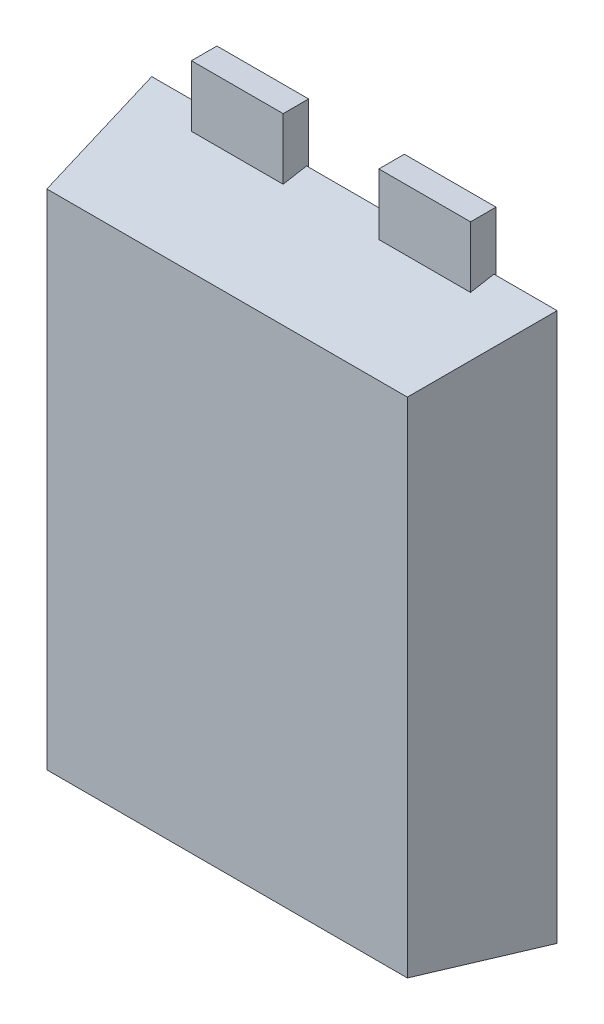
from build123d import *

# Parameters (mm, degrees)
BOSS_EXTRUDE1_DEPTH   = 0.25
SKETCH2_W             = 0.9
SKETCH2_H             = 0.85
BOSS_EXTRUDE1_2_DEPTH = 0.25
BOSS_EXTRUDE1_3_DEPTH = 0.25
SKETCH3_W             = 3.98
SKETCH3_H             = 5.38
BOSS_EXTRUDE2_DEPTH   = 1.25
CHAMFER6_SIZE         = 1.25
CHAMFER6_SIZE_2       = 0.220408726
CHAMFER7_SIZE         = 1.25
CHAMFER7_SIZE_2       = 0.220408726
CHAMFER8_SIZE         = 1.25
CHAMFER8_SIZE_2       = 0.220408726


with BuildPart() as part:
    # Sketch2 → Boss-Extrude1 (new body)
    with BuildSketch(Plane.XY):
        Polygon((-1.525, 1.15), (-1.525, -2.4), (-0.9, -2.4), (-0.9, -3.25), (-0.55, -3.25), (-0.55, -3.05), (0.55, -3.05), (0.55, -3.25), (0.9, -3.25), (0.9, -2.4), (1.525, -2.4), (1.525, 1.15), align=None)
    extrude(amount=BOSS_EXTRUDE1_DEPTH)

    # Sketch3 → Boss-Extrude2 (add)
    with BuildSketch(Plane.XY.offset(0.02)):
        Rectangle(SKETCH3_W, SKETCH3_H)
    extrude(amount=BOSS_EXTRUDE2_DEPTH)

    # Chamfer6
    # the kernel refuses this chamfer: 1.25, 0.220408726 mm, written as the material it takes off along each edge
    with BuildSketch(Plane(origin=(5.238173496, -2.69, 1.27), x_dir=(0, -0.006682531656101757, -0.9999776716360547), z_dir=(-1, 0, 0))) as chamfer6_piece_1_section:
        Polygon((CHAMFER6_SIZE * 0.999977671636, -CHAMFER6_SIZE * 0.0066825316561), (-CHAMFER6_SIZE_2 * 0.00668253165263, -CHAMFER6_SIZE_2 * 0.999977671117), (0, 0), align=None)
    chamfer6_piece_1 = extrude(amount=10.476346991, mode=Mode.PRIVATE)
    chamfer6_piece_1 = split(chamfer6_piece_1, bisect_by=Plane(origin=(0.9, -2.695482191, 0.132342406), z_dir=(1, 0, 0)), keep=Keep.TOP, mode=Mode.PRIVATE)
    chamfer6_piece_1 = split(chamfer6_piece_1, bisect_by=Plane(origin=(3.069086748, -2.695482191, 0.25), z_dir=(0, 0, -1)), keep=Keep.TOP, mode=Mode.PRIVATE)
    add(chamfer6_piece_1, mode=Mode.SUBTRACT)
    with BuildSketch(Plane(origin=(5.238173496, -2.69, 1.27), x_dir=(0, -0.006682531656101757, -0.9999776716360547), z_dir=(-1, 0, 0))) as chamfer6_piece_2_section:
        Polygon((CHAMFER6_SIZE * 0.999977671636, -CHAMFER6_SIZE * 0.0066825316561), (-CHAMFER6_SIZE_2 * 0.00668253165263, -CHAMFER6_SIZE_2 * 0.999977671117), (0, 0), align=None)
    chamfer6_piece_2 = extrude(amount=10.476346991, mode=Mode.PRIVATE)
    chamfer6_piece_2 = split(chamfer6_piece_2, bisect_by=Plane(origin=(0.9, -2.625359241, 0.876081369), z_dir=(1, 0, 0)), keep=Keep.TOP, mode=Mode.PRIVATE)
    chamfer6_piece_2 = split(chamfer6_piece_2, bisect_by=Plane(origin=(3.069086748, -2.625359241, 0.25), z_dir=(0, 0, 1)), keep=Keep.TOP, mode=Mode.PRIVATE)
    add(chamfer6_piece_2, mode=Mode.SUBTRACT)
    with BuildSketch(Plane(origin=(5.238173496, -2.69, 1.27), x_dir=(0, -0.006682531656101757, -0.9999776716360547), z_dir=(-1, 0, 0))) as chamfer6_piece_3_section:
        Polygon((CHAMFER6_SIZE * 0.999977671636, -CHAMFER6_SIZE * 0.0066825316561), (-CHAMFER6_SIZE_2 * 0.00668253165263, -CHAMFER6_SIZE_2 * 0.999977671117), (0, 0), align=None)
    chamfer6_piece_3 = extrude(amount=10.476346991, mode=Mode.PRIVATE)
    chamfer6_piece_3 = split(chamfer6_piece_3, bisect_by=Plane(origin=(-0.9, -2.625359241, 0.876081369), z_dir=(1, 0, 0)), keep=Keep.TOP, mode=Mode.PRIVATE)
    chamfer6_piece_3 = split(chamfer6_piece_3, bisect_by=Plane(origin=(0.9, -2.625359241, 0.876081369), z_dir=(-1, 0, 0)), keep=Keep.TOP, mode=Mode.PRIVATE)
    chamfer6_piece_3 = split(chamfer6_piece_3, bisect_by=Plane(origin=(0, -2.625359241, 0.25), z_dir=(0, 0, 1)), keep=Keep.TOP, mode=Mode.PRIVATE)
    add(chamfer6_piece_3, mode=Mode.SUBTRACT)
    with BuildSketch(Plane(origin=(5.238173496, -2.69, 1.27), x_dir=(0, -0.006682531656101757, -0.9999776716360547), z_dir=(-1, 0, 0))) as chamfer6_piece_4_section:
        Polygon((CHAMFER6_SIZE * 0.999977671636, -CHAMFER6_SIZE * 0.0066825316561), (-CHAMFER6_SIZE_2 * 0.00668253165263, -CHAMFER6_SIZE_2 * 0.999977671117), (0, 0), align=None)
    chamfer6_piece_4 = extrude(amount=10.476346991, mode=Mode.PRIVATE)
    chamfer6_piece_4 = split(chamfer6_piece_4, bisect_by=Plane(origin=(-0.9, -2.695482191, 0.132342406), z_dir=(-1, 0, 0)), keep=Keep.TOP, mode=Mode.PRIVATE)
    chamfer6_piece_4 = split(chamfer6_piece_4, bisect_by=Plane(origin=(-3.069086748, -2.695482191, 0.25), z_dir=(0, 0, -1)), keep=Keep.TOP, mode=Mode.PRIVATE)
    add(chamfer6_piece_4, mode=Mode.SUBTRACT)
    with BuildSketch(Plane(origin=(5.238173496, -2.69, 1.27), x_dir=(0, -0.006682531656101757, -0.9999776716360547), z_dir=(-1, 0, 0))) as chamfer6_piece_5_section:
        Polygon((CHAMFER6_SIZE * 0.999977671636, -CHAMFER6_SIZE * 0.0066825316561), (-CHAMFER6_SIZE_2 * 0.00668253165263, -CHAMFER6_SIZE_2 * 0.999977671117), (0, 0), align=None)
    chamfer6_piece_5 = extrude(amount=10.476346991, mode=Mode.PRIVATE)
    chamfer6_piece_5 = split(chamfer6_piece_5, bisect_by=Plane(origin=(-0.9, -2.625359241, 0.876081369), z_dir=(-1, 0, 0)), keep=Keep.TOP, mode=Mode.PRIVATE)
    chamfer6_piece_5 = split(chamfer6_piece_5, bisect_by=Plane(origin=(-3.069086748, -2.625359241, 0.25), z_dir=(0, 0, 1)), keep=Keep.TOP, mode=Mode.PRIVATE)
    add(chamfer6_piece_5, mode=Mode.SUBTRACT)

    # Chamfer7
    # the kernel refuses this chamfer: 1.25, 0.220408726 mm, written as the material it takes off along each edge
    with BuildSketch(Plane(origin=(-5.238173496, 2.69, 1.27), x_dir=(0, 0.006682531656101757, -0.9999776716360547), z_dir=(1, 0, 0))) as chamfer7_piece_1:
        Polygon((CHAMFER7_SIZE * 0.999977671636, -CHAMFER7_SIZE * 0.0066825316561), (-CHAMFER7_SIZE_2 * 0.00668253165263, -CHAMFER7_SIZE_2 * 0.999977671117), (0, 0), align=None)
    extrude(amount=10.476346991, mode=Mode.SUBTRACT)

    # Chamfer8
    # the kernel refuses this chamfer: 1.25, 0.220408726 mm, written as the material it takes off along each edge
    with BuildSketch(Plane(origin=(-1.99, -5.71776477, 1.27), x_dir=(-0.006682531656101757, 0, -0.9999776716360547), z_dir=(0, 1, 0)), Plane(origin=(1.99, 5.71776477, 1.27), x_dir=(0.006682531656101757, 0, -0.9999776716360547), z_dir=(0, -1, 0))) as chamfer8_piece_1:
        Polygon((CHAMFER8_SIZE * 0.999977671636, -CHAMFER8_SIZE * 0.0066825316561), (-CHAMFER8_SIZE_2 * 0.00668253165263, -CHAMFER8_SIZE_2 * 0.999977671117), (0, 0), align=None)
    extrude(amount=11.435529539, mode=Mode.SUBTRACT)


with BuildPart() as body_2:
    # Sketch2 → Boss-Extrude1 2 (new body)
    with BuildSketch(Plane.XY):
        with Locations((-0.92, 2.825)):
            Rectangle(SKETCH2_W, SKETCH2_H)
    extrude(amount=BOSS_EXTRUDE1_2_DEPTH)


with BuildPart() as body_3:
    # Sketch2 → Boss-Extrude1 3 (new body)
    with BuildSketch(Plane.XY):
        with Locations((0.92, 2.825)):
            Rectangle(SKETCH2_W, SKETCH2_H)
    extrude(amount=BOSS_EXTRUDE1_3_DEPTH)


solid = Compound([part.part, body_2.part, body_3.part])
